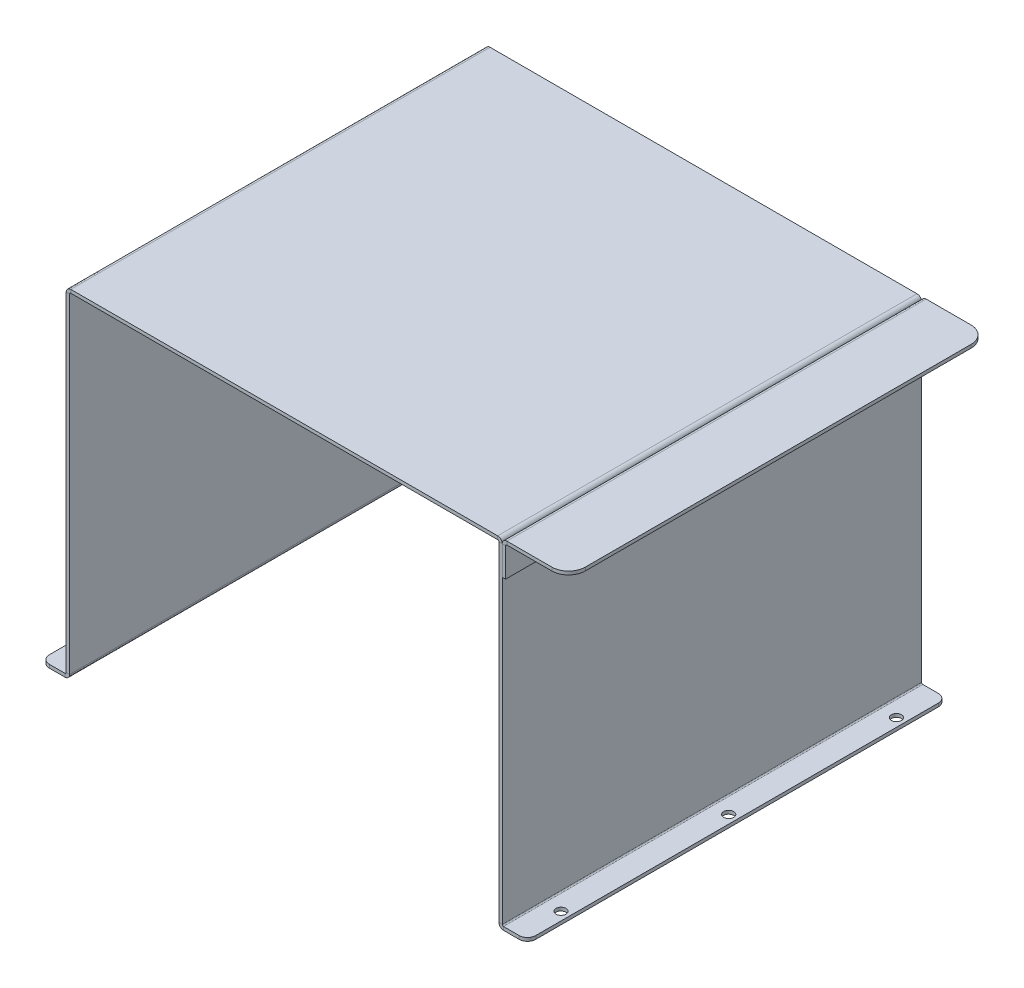
from build123d import *

# Parameters (mm, degrees)
SM_BASE_FLANGE_1_DEPTH = 250
SM_BASE_FLANGE_2_DEPTH = 250
FILLET_1_R             = 10
FILLET_2_R             = 5
SKETCH_9_R             = 3
CUT_EXTRUDE_1_DEPTH    = 10


# Sheet-metal steps are written as plain solids
with BuildPart() as part:
    # Sketch 1 → 基体-法兰1 (new body)
    with BuildSketch(Plane.XY):
        with BuildLine():
            Line((-371.526300738, 138.546722129), (-357.262900738, 138.546722129))
            ThreePointArc((-357.262900738, 138.546722129), (-356.742045883, 138.762467274), (-356.526300738, 139.283322129))
            Line((-356.526300738, 139.283322129), (-356.526300738, 335.810122129))
            ThreePointArc((-356.526300738, 335.810122129), (-355.724769156, 337.745190547), (-353.789700738, 338.546722129))
            Line((-353.789700738, 338.546722129), (-99.262900738, 338.546722129))
            ThreePointArc((-99.262900738, 338.546722129), (-97.327832321, 337.745190547), (-96.526300738, 335.810122129))
            Line((-96.526300738, 335.810122129), (-96.526300738, 139.283322129))
            ThreePointArc((-96.526300738, 139.283322129), (-96.310555593, 138.762467274), (-95.789700738, 138.546722129))
            Line((-95.789700738, 138.546722129), (-81.526300738, 138.546722129))
            Line((-81.526300738, 138.546722129), (-81.526300738, 136.546722129))
            Line((-81.526300738, 136.546722129), (-95.789700738, 136.546722129))
            ThreePointArc((-95.789700738, 136.546722129), (-97.724769156, 137.348253712), (-98.526300738, 139.283322129))
            Line((-98.526300738, 139.283322129), (-98.526300738, 335.810122129))
            ThreePointArc((-98.526300738, 335.810122129), (-98.742045883, 336.330976984), (-99.262900738, 336.546722129))
            Line((-99.262900738, 336.546722129), (-353.789700738, 336.546722129))
            ThreePointArc((-353.789700738, 336.546722129), (-354.310555593, 336.330976984), (-354.526300738, 335.810122129))
            Line((-354.526300738, 335.810122129), (-354.526300738, 139.283322129))
            ThreePointArc((-354.526300738, 139.283322129), (-355.327832321, 137.348253712), (-357.262900738, 136.546722129))
            Line((-357.262900738, 136.546722129), (-371.526300738, 136.546722129))
            Line((-371.526300738, 136.546722129), (-371.526300738, 138.546722129))
        make_face()
    extrude(amount=SM_BASE_FLANGE_1_DEPTH)

    # 圆角2
    fillet_2_edges = [part.edges().sort_by_distance(p)[0] for p in [
        (-371.526300738, 137.546722129, 0),
        (-81.526300738, 137.546722129, 0),
        (-371.526300738, 137.546722129, 250),
        (-81.526300738, 137.546722129, 250),
    ]]
    fillet(fillet_2_edges, radius=FILLET_2_R)

    # 草图9 → 切除-拉伸1 (cut)
    with BuildSketch(Plane.XZ.offset(-136.546722129)):
        with Locations(Location((-366.526300738, 225, 0), (0, 0, 270))):
            Circle(SKETCH_9_R)
        with Locations(Location((-366.526300738, 125, 0), (0, 0, 270))):
            Circle(SKETCH_9_R)
        with Locations(Location((-366.526300738, 25, 0), (0, 0, 270))):
            Circle(SKETCH_9_R)
    cut_extrude_1 = extrude(amount=-CUT_EXTRUDE_1_DEPTH, mode=Mode.SUBTRACT)

    # 镜向1: 切除-拉伸1 across plane
    add(cut_extrude_1.mirror(Plane(origin=(-226.526300738, 0, 0), x_dir=(0, 0, 1), z_dir=(1, 0, 0))), mode=Mode.SUBTRACT)


with BuildPart() as body_2:
    # 草图6 → 基体-法兰2 (new body)
    with BuildSketch(Plane.XY.offset(250)):
        with BuildLine():
            Line((-96.526300738, 318.546722129), (-96.526300738, 335.810122129))
            ThreePointArc((-96.526300738, 335.810122129), (-95.724769156, 337.745190547), (-93.789700738, 338.546722129))
            Line((-93.789700738, 338.546722129), (-56.999497946, 338.546722129))
            Line((-56.999497946, 338.546722129), (-56.999497946, 336.546722129))
            Line((-56.999497946, 336.546722129), (-93.789700738, 336.546722129))
            ThreePointArc((-93.789700738, 336.546722129), (-94.310555593, 336.330976984), (-94.526300738, 335.810122129))
            Line((-94.526300738, 335.810122129), (-94.526300738, 318.546722129))
            Line((-94.526300738, 318.546722129), (-96.526300738, 318.546722129))
        make_face()
    extrude(amount=-SM_BASE_FLANGE_2_DEPTH)

    # 圆角1
    fillet_1_edges = [body_2.edges().sort_by_distance(p)[0] for p in [
        (-56.999497946, 337.546722129, 0),
        (-56.999497946, 337.546722129, 250),
    ]]
    fillet(fillet_1_edges, radius=FILLET_1_R)


solid = Compound([part.part, body_2.part])
